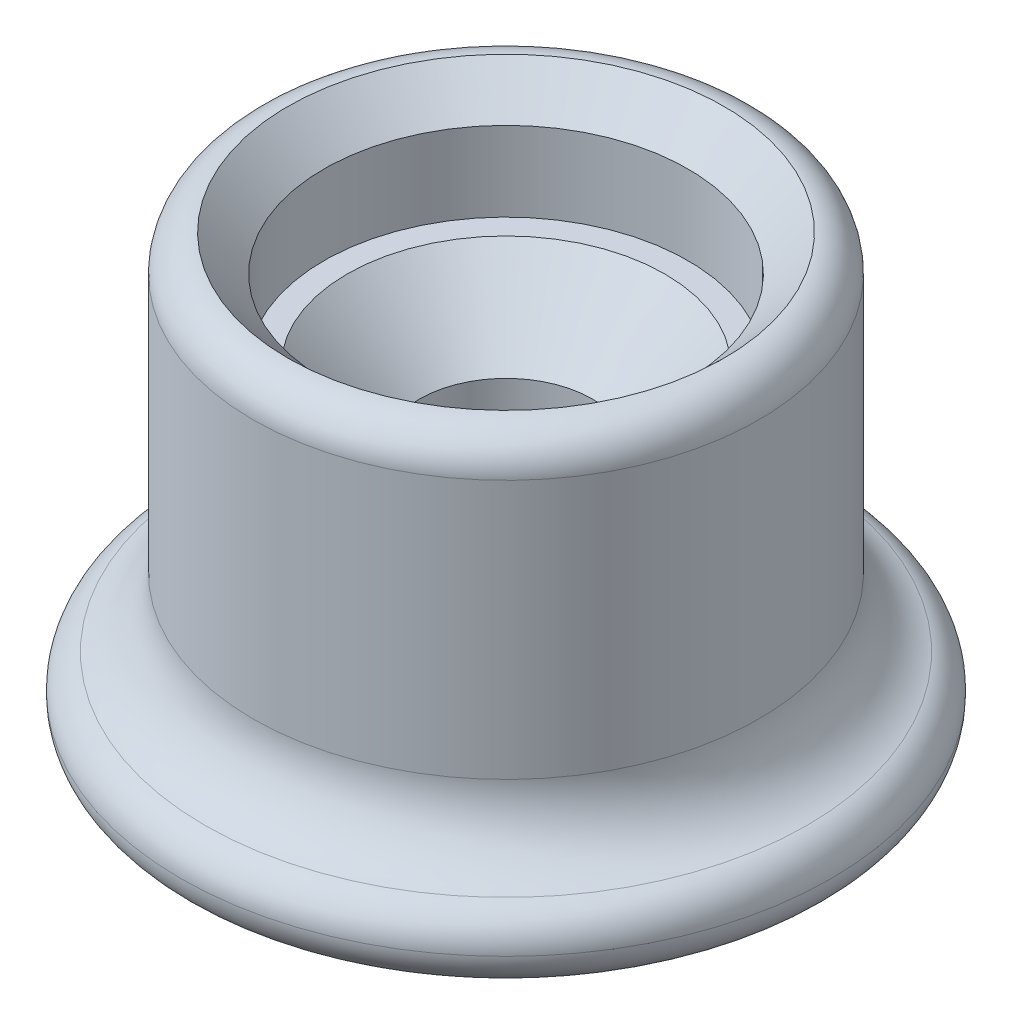
from build123d import *

# Parameters (mm, degrees)
SKETCH4_R           = 5.55625
SKETCH4_R_2         = 1.905
BOSS_EXTRUDE3_DEPTH = 9.525
SKETCH5_R           = 7.14375
SKETCH5_R_2         = 1.905
BOSS_EXTRUDE4_DEPTH = 1.5875
FILLET4_R           = 0.79375
FILLET5_R           = 1.5875
SKETCH6_R           = 4.0005
CUT_EXTRUDE1_DEPTH  = 2.54
CHAMFER1_SIZE       = 0.79375
CHAMFER2_SIZE       = 1.5875


with BuildPart() as part:
    # Sketch4 → Boss-Extrude3 (new body)
    with BuildSketch(Plane(origin=(0, 0, 0), x_dir=(1, 0, 0), z_dir=(0, 1, 0))):
        with Locations(Location((0, 0, 0), (0, 0, 90))):
            Circle(SKETCH4_R)
        with Locations(Location((0, 0, 0), (0, 0, 90))):
            Circle(SKETCH4_R_2, mode=Mode.SUBTRACT)
    extrude(amount=BOSS_EXTRUDE3_DEPTH)

    # Sketch5 → Boss-Extrude4 (add)
    with BuildSketch(Plane(origin=(0, 0, 0), x_dir=(-1, 0, 0), z_dir=(0, -1, 0))):
        with Locations(Location((0, 0, 0), (0, 0, 90))):
            Circle(SKETCH5_R)
        with Locations(Location((0, 0, 0), (0, 0, 90))):
            Circle(SKETCH5_R_2, mode=Mode.SUBTRACT)
    extrude(amount=-BOSS_EXTRUDE4_DEPTH)

    # Fillet4
    fillet4_edges = [part.edges().sort_by_distance(p)[0] for p in [
        (0, 0, 7.14375),
        (0, 1.5875, 7.14375),
        (0, 9.525, 5.55625),
    ]]
    fillet(fillet4_edges, radius=FILLET4_R - 0.0001)  # a hair under: the kernel refuses the full size

    # Fillet5
    fillet5_edges = [part.edges().sort_by_distance(p)[0] for p in [
        (0, 1.5875, 5.55625),
    ]]
    fillet(fillet5_edges, radius=FILLET5_R)

    # Sketch6 → Cut-Extrude1 (cut)
    with BuildSketch(Plane(origin=(0, 9.525, 0), x_dir=(1, 0, 0), z_dir=(0, 1, 0))):
        with Locations(Location((0, 0, 0), (0, 0, 270))):
            Circle(SKETCH6_R)
    extrude(amount=-CUT_EXTRUDE1_DEPTH, mode=Mode.SUBTRACT)

    # Chamfer1
    chamfer1_edges = [part.edges().sort_by_distance(p)[0] for p in [
        (0, 9.525, -4.0005),
    ]]
    chamfer(chamfer1_edges, length=CHAMFER1_SIZE)

    # Chamfer2
    chamfer2_edges = [part.edges().sort_by_distance(p)[0] for p in [
        (0, 6.985, 1.905),
    ]]
    chamfer(chamfer2_edges, length=CHAMFER2_SIZE)


solid = part.part
